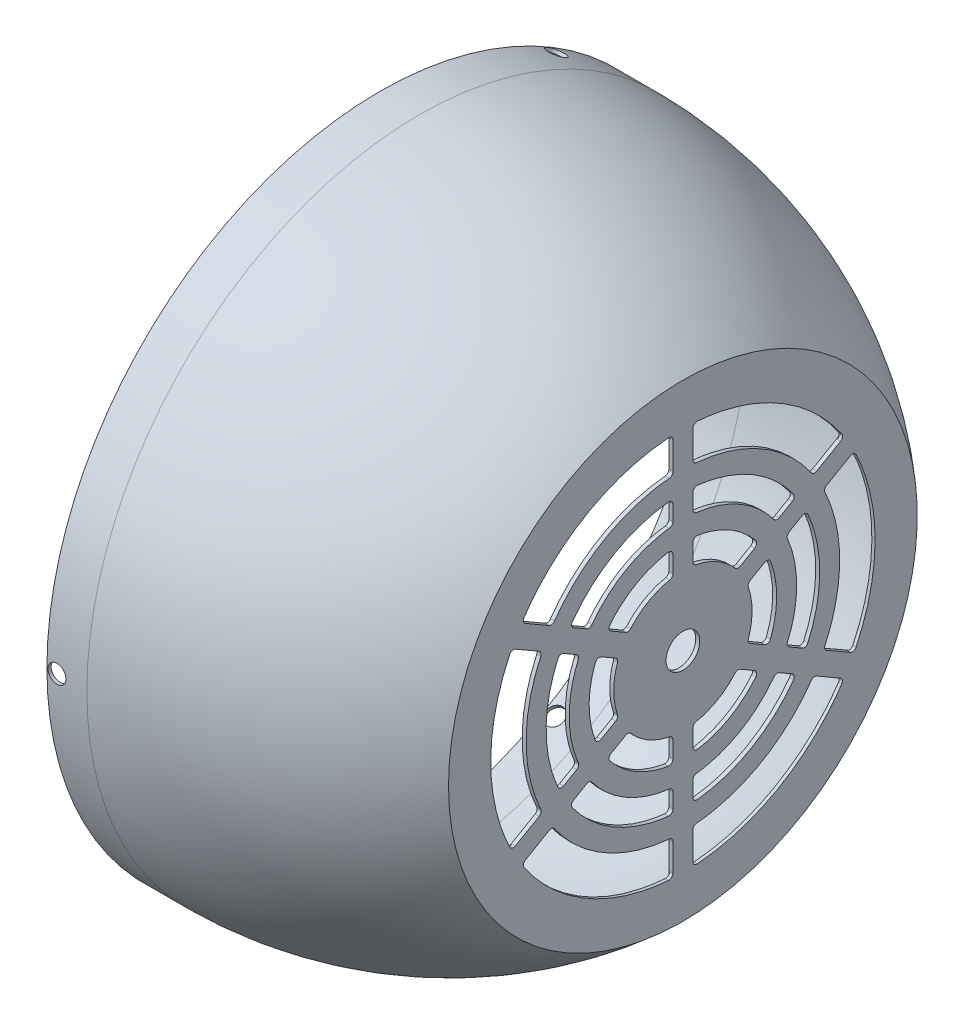
from build123d import *

# Parameters (mm, degrees)
RESPIRADOURO1_START              = 75
RESPIRADOURO1_DEPTH              = 0.8
RESPIRADOURO1_START_2            = 74.8
RESPIRADOURO1_2_DEPTH            = 0.2
FURO_DE_DI_METRO_4_5_4_5_1_D     = 4.5
FURO_DE_DI_METRO_4_5_4_5_1_DEPTH = 20
CIRPATTERN1_COUNT                = 3


with BuildPart() as part:
    # Esboço1 → Revolução1 (revolve)
    with BuildSketch(Plane.XY, mode=Mode.PRIVATE) as revolu_o1_sk:
        with BuildLine():
            Line((0, 82.5), (10, 82.5))
            ThreePointArc((10, 82.5), (44.684631464, 76.245520018), (75, 58.26996411))
            Line((75, 58.26996411), (75, 0))
            Line((75, 0), (75.8, 0))
            Line((75.8, 0), (75.8, 58.634605337))
            ThreePointArc((75.8, 58.634605337), (45.135529361, 76.931035824), (10, 83.3))
            Line((10, 83.3), (0, 83.3))
            Line((0, 83.3), (0, 82.5))
        make_face()
    revolve(revolu_o1_sk.sketch.rotate(Axis((0, 0, 0), (1, 0, 0)), 90), axis=Axis((0, 0, 0), (1, 0, 0)))

    # Respiradouro1: read off the stored shape, not the designer's step
    # Respiradouro1 outline → Respiradouro1 (cut)
    with BuildSketch(Plane.YZ.offset(RESPIRADOURO1_START)):
        with BuildLine():
            add(Edge.make_bspline(
                [(11.202317924, 26.165455629), (11.099201301, 26.209607209), (9.278991285, 26.976241101), (5.588584912, 28.095713635), (0, 28.646141206), (-5.588584912, 28.095713635), (-9.278991285, 26.976241101), (-11.099201301, 26.209607209), (-11.202317924, 26.165455629)],
                knots=[0.435618298, 0.435618298, 0.435618298, 0.435618298, 0.4375, 0.46875, 0.5, 0.53125, 0.5625, 0.564381702, 0.564381702, 0.564381702, 0.564381702], degree=3))
            ThreePointArc((11.202317924, 26.165455629), (11.911747556, 26.135915026), (12.46195186, 26.584733783))
            Line((12.46195186, 26.584733783), (14.351595385, 29.857692377))
            ThreePointArc((14.351595385, 29.857692377), (14.436476067, 30.667171967), (13.891417662, 31.271633108))
            add(Edge.make_bspline(
                [(13.891417662, 31.271633108), (13.627304229, 31.388916232), (12.332608407, 31.944388515), (9.949287535, 32.798114477), (6.686450495, 33.614199908), (3.35952005, 34.108917613), (0.000167139, 34.272774263), (-3.359351906, 34.108934174), (-6.686122639, 33.614265123), (-9.949125853, 32.798163523), (-12.33245469, 31.944454403), (-13.627304232, 31.388916275), (-13.891417641, 31.271633179)],
                knots=[0.433467712, 0.433467712, 0.433467712, 0.433467712, 0.437499982, 0.453123814, 0.468749982, 0.484373814, 0.499999982, 0.515623814, 0.531249982, 0.546873814, 0.562499982, 0.566532252, 0.566532252, 0.566532252, 0.566532252], degree=3))
            ThreePointArc((-13.891417641, 31.271633179), (-14.436476087, 30.667172041), (-14.351595414, 29.857692426))
            Line((-14.351595414, 29.857692426), (-12.46195186, 26.584733783))
            ThreePointArc((-12.46195186, 26.584733783), (-11.911747555, 26.135915026), (-11.202317924, 26.165455629))
        make_face()
        with BuildLine():
            ThreePointArc((8.929084626, 20.465628237), (9.00579619, 21.299165355), (8.421961382, 21.899003424))
            add(Edge.make_bspline(
                [(8.421961382, 21.899003424), (7.175195583, 22.378410789), (4.406987657, 23.179859838), (0, 23.613910237), (-4.406987659, 23.179859838), (-7.175195586, 22.378410788), (-8.421961399, 21.899003418)],
                knots=[0.441567134, 0.441567134, 0.441567134, 0.441567134, 0.46875, 0.5, 0.53125, 0.558432866, 0.558432866, 0.558432866, 0.558432866], degree=3))
            ThreePointArc((-8.421961399, 21.899003418), (-9.00579619, 21.299165355), (-8.929084626, 20.465628237))
            Line((-8.929084626, 20.465628237), (-6.820623286, 16.813666071))
            ThreePointArc((-6.820623286, 16.813666071), (-6.304996669, 16.377065468), (-5.629416197, 16.368014512))
            add(Edge.make_bspline(
                [(5.629416235, 16.368014499), (4.893356498, 16.62112374), (3.04408919, 17.120832539), (0, 17.420649155), (-3.04408919, 17.120832539), (-4.893356498, 16.62112374), (-5.629416197, 16.368014512)],
                knots=[0.447279142, 0.447279142, 0.447279142, 0.447279142, 0.46875, 0.5, 0.53125, 0.552720858, 0.552720858, 0.552720858, 0.552720858], degree=3))
            ThreePointArc((5.629416235, 16.368014499), (6.304996669, 16.377065468), (6.820623286, 16.813666071))
            Line((6.820623286, 16.813666071), (8.929084626, 20.465628237))
        make_face()
        with BuildLine():
            add(Edge.make_bspline(
                [(16.57920603, 35.541639505), (16.06063152, 35.783430625), (14.361785376, 36.530786118), (11.403086127, 37.590617055), (7.663475431, 38.525950281), (3.850413438, 39.092955633), (0.000183853, 39.280754839), (-3.850228479, 39.09297385), (-7.66311479, 38.526022017), (-11.402908276, 37.590671006), (-14.361617076, 36.530860112), (-16.060631604, 35.783430673), (-16.579206096, 35.541639576)],
                knots=[0.430534071, 0.430534071, 0.430534071, 0.430534071, 0.437499984, 0.453123863, 0.468749984, 0.484373863, 0.499999984, 0.515623863, 0.531249984, 0.546873863, 0.562499984, 0.569465897, 0.569465897, 0.569465897, 0.569465897], degree=3))
            ThreePointArc((16.57920603, 35.541639505), (17.302513666, 35.494252256), (17.867815032, 35.947963456))
            Line((17.867815032, 35.947963456), (21.308612208, 41.907598983))
            ThreePointArc((21.308612208, 41.907598983), (21.398189847, 42.702256112), (20.876655416, 43.308478797))
            add(Edge.make_bspline(
                [(20.876655416, 43.308478797), (20.061216664, 43.701379561), (17.798043902, 44.714090442), (13.978954634, 46.082117527), (9.39456772, 47.228738911), (4.720177793, 47.923821321), (0.000183853, 48.154041177), (-4.719992834, 47.923839538), (-9.394207079, 47.228810647), (-13.978776783, 46.082171478), (-17.797876126, 44.714165491), (-20.061216745, 43.701379633), (-20.876655468, 43.308478879)],
                knots=[0.428510709, 0.428510709, 0.428510709, 0.428510709, 0.437499987, 0.453124073, 0.468749987, 0.484374073, 0.499999987, 0.515624073, 0.531249987, 0.546874073, 0.562499987, 0.571489266, 0.571489266, 0.571489266, 0.571489266], degree=3))
            ThreePointArc((-20.876655468, 43.308478879), (-21.398189896, 42.702256194), (-21.308612256, 41.907599066))
            Line((-21.308612256, 41.907599066), (-17.867815078, 35.947963535))
            ThreePointArc((-17.867815078, 35.947963535), (-17.302513722, 35.494252339), (-16.579206096, 35.541639576))
        make_face()
        with BuildLine():
            ThreePointArc((27.067560602, 39.733807858), (26.28186878, 39.882200138), (25.638578861, 39.40732122))
            Line((25.638578861, 39.40732122), (22.197876991, 33.447850769))
            ThreePointArc((22.197876991, 33.447850769), (22.087632694, 32.73129253), (22.490525042, 32.128559362))
            add(Edge.make_bspline(
                [(39.069802621, 3.413050447), (39.057263696, 3.55671349), (38.925234666, 4.978314499), (38.526022017, 7.66311479), (37.590671005, 11.402908276), (36.290755775, 15.031924229), (34.643779755, 18.517380702), (32.66085614, 21.82306525), (30.365547477, 24.920240572), (27.775818121, 27.775558113), (25.130646219, 30.174722477), (23.309816803, 31.55518176), (22.490525042, 32.128559362)],
                knots=[0.263868157, 0.263868157, 0.263868157, 0.263868157, 0.265623863, 0.281249984, 0.296873863, 0.312499984, 0.328123863, 0.343749984, 0.359373863, 0.374999984, 0.390623863, 0.402798226, 0.402798226, 0.402798226, 0.402798226], degree=3))
            ThreePointArc((39.069802621, 3.413050447), (39.390348834, 2.762792583), (40.066015337, 2.5))
            Line((40.066015337, 2.5), (46.94749146, 2.5))
            ThreePointArc((46.94749146, 2.5), (47.680364043, 2.819634086), (47.94473451, 3.574204447))
            add(Edge.make_bspline(
                [(47.94473451, 3.574204447), (47.916481198, 3.953904314), (47.748240088, 5.900935754), (47.228810647, 9.394207079), (46.082171477, 13.978776783), (44.488603409, 18.427583902), (42.46959141, 22.700364179), (40.038724092, 26.752799009), (37.224928762, 30.549589311), (34.050179062, 34.049919054), (30.656259967, 37.128191268), (28.249276526, 38.928889255), (27.067560602, 39.733807858)],
                knots=[0.261842752, 0.261842752, 0.261842752, 0.261842752, 0.265624073, 0.281249987, 0.296874073, 0.312499987, 0.328124073, 0.343749987, 0.359374073, 0.374999987, 0.390624073, 0.40482344, 0.40482344, 0.40482344, 0.40482344], degree=3))
        make_face()
        with BuildLine():
            Line((-22.197877028, 33.447850833), (-25.638578876, 39.407321247))
            ThreePointArc((-25.638578876, 39.407321247), (-26.28186876, 39.882200157), (-27.067560557, 39.733807926))
            add(Edge.make_bspline(
                [(-27.067560557, 39.733807926), (-28.249124374, 38.928993057), (-30.656116997, 37.128309829), (-34.049921737, 34.050175863), (-37.224815192, 30.54973107), (-40.038526477, 26.753094103), (-42.469507903, 22.700520733), (-44.488469057, 18.427908151), (-46.082119989, 13.978946557), (-47.228742169, 9.394551326), (-47.74821635, 5.901110579), (-47.916468093, 3.954079667), (-47.944734441, 3.574204409)],
                knots=[0.595176533, 0.595176533, 0.595176533, 0.595176533, 0.609374073, 0.624999987, 0.640624114, 0.656249987, 0.671874156, 0.687499987, 0.703124156, 0.718749987, 0.734374156, 0.738157224, 0.738157224, 0.738157224, 0.738157224], degree=3))
            ThreePointArc((-47.944734441, 3.574204409), (-47.680363959, 2.819634072), (-46.947491389, 2.5))
            Line((-46.947491389, 2.5), (-40.066015297, 2.5))
            ThreePointArc((-40.066015297, 2.5), (-39.390348765, 2.762792608), (-39.069802575, 3.413050524))
            add(Edge.make_bspline(
                [(-22.490525142, 32.128559381), (-23.309666011, 31.555287476), (-25.130504144, 30.174841766), (-27.775560795, 27.775814921), (-30.365433908, 24.920382331), (-32.660658525, 21.823360345), (-34.643696248, 18.517537255), (-36.290621423, 15.032248479), (-37.590619517, 11.40307805), (-38.525953539, 7.663459036), (-38.925209835, 4.978489073), (-39.057248372, 3.556888726), (-39.069802575, 3.413050524)],
                knots=[0.597201742, 0.597201742, 0.597201742, 0.597201742, 0.609373863, 0.624999984, 0.640623914, 0.656249984, 0.671873966, 0.687499984, 0.703123966, 0.718749984, 0.734373966, 0.736131812, 0.736131812, 0.736131812, 0.736131812], degree=3))
            ThreePointArc((-22.490525142, 32.128559381), (-22.087632739, 32.731292555), (-22.197877028, 33.447850833))
        make_face()
        with BuildLine():
            ThreePointArc((47.944734437, -3.574204407), (47.680363954, -2.819634072), (46.947491385, -2.5))
            Line((46.947491385, -2.5), (40.066015295, -2.5))
            ThreePointArc((40.066015295, -2.5), (39.390348762, -2.76279261), (39.069802572, -3.413050527))
            add(Edge.make_bspline(
                [(22.490525132, -32.128559389), (23.309665984, -31.555287482), (25.130504066, -30.174841679), (27.775558113, -27.775818127), (30.365429573, -24.920384237), (32.660651853, -21.823370988), (34.643692144, -18.51754461), (36.290615059, -15.032263946), (37.590617055, -11.403086127), (38.525950281, -7.663475431), (38.925208652, -4.978497386), (39.057247642, -3.556897071), (39.069802572, -3.413050527)],
                knots=[0.097201742, 0.097201742, 0.097201742, 0.097201742, 0.109373863, 0.124999984, 0.140623863, 0.156249984, 0.171873863, 0.187499984, 0.203123863, 0.218749984, 0.234373863, 0.236131812, 0.236131812, 0.236131812, 0.236131812], degree=3))
            ThreePointArc((22.490525132, -32.128559389), (22.087632739, -32.731292562), (22.197877029, -33.447850834))
            Line((22.197877029, -33.447850834), (25.638578878, -39.40732125))
            ThreePointArc((25.638578878, -39.40732125), (26.281868761, -39.882200159), (27.067560557, -39.73380793))
            add(Edge.make_bspline(
                [(27.067560557, -39.73380793), (28.249124356, -38.928993078), (30.656116896, -37.12830972), (34.049919055, -34.050179068), (37.224810858, -30.549732976), (40.038519805, -26.753104747), (42.469503799, -22.700528088), (44.488462694, -18.427923618), (46.082117527, -13.978954634), (47.228738911, -9.39456772), (47.748215219, -5.901118904), (47.916467469, -3.954088017), (47.944734437, -3.574204407)],
                knots=[0.095176533, 0.095176533, 0.095176533, 0.095176533, 0.109374073, 0.124999987, 0.140624073, 0.156249987, 0.171874073, 0.187499987, 0.203124073, 0.218749987, 0.234374073, 0.238157223, 0.238157223, 0.238157223, 0.238157223], degree=3))
        make_face()
        with BuildLine():
            Line((-40.066015336, -2.5), (-46.947491457, -2.5))
            ThreePointArc((-46.947491457, -2.5), (-47.68036404, -2.819634086), (-47.944734507, -3.574204445))
            add(Edge.make_bspline(
                [(-47.944734507, -3.574204445), (-47.916480574, -3.953912664), (-47.748238959, -5.900944079), (-47.228807386, -9.394223472), (-46.082169026, -13.978784867), (-44.488597013, -18.427599343), (-42.469587429, -22.70037163), (-40.038714806, -26.752812906), (-37.224923404, -30.549595844), (-34.050167242, -34.049930866), (-30.656253472, -37.128196672), (-28.249269612, -38.928893922), (-27.067560612, -39.733807839)],
                knots=[0.761842752, 0.761842752, 0.761842752, 0.761842752, 0.765624156, 0.781249987, 0.796874156, 0.812499987, 0.828124156, 0.843749987, 0.859374156, 0.874999987, 0.890624156, 0.90482344, 0.90482344, 0.90482344, 0.90482344], degree=3))
            ThreePointArc((-27.067560612, -39.733807839), (-26.281868784, -39.882200132), (-25.638578856, -39.407321212))
            Line((-25.638578856, -39.407321212), (-22.197876983, -33.447850754))
            ThreePointArc((-22.197876983, -33.447850754), (-22.087632685, -32.731292519), (-22.490525026, -32.128559352))
            add(Edge.make_bspline(
                [(-39.06980262, -3.413050451), (-39.057262966, -3.556721834), (-38.925233484, -4.978322812), (-38.526018756, -7.663131183), (-37.590668554, -11.40291636), (-36.290749378, -15.031939671), (-34.643775774, -18.517388153), (-32.660846854, -21.823079147), (-30.365542119, -24.920247105), (-27.775806301, -27.775569925), (-25.130639756, -30.174727923), (-23.309809932, -31.555186538), (-22.490525026, -32.128559352)],
                knots=[0.763868157, 0.763868157, 0.763868157, 0.763868157, 0.765623966, 0.781249984, 0.796873966, 0.812499984, 0.828123966, 0.843749984, 0.859373966, 0.874999984, 0.890623966, 0.902798227, 0.902798227, 0.902798227, 0.902798227], degree=3))
            ThreePointArc((-39.06980262, -3.413050451), (-39.390348831, -2.762792584), (-40.066015336, -2.5))
        make_face()
        with BuildLine():
            ThreePointArc((20.876655724, -43.308479079), (21.39819006, -42.702256388), (21.308612402, -41.907599319))
            Line((21.308612402, -41.907599319), (17.867815251, -35.947963835))
            ThreePointArc((17.867815251, -35.947963835), (17.302513866, -35.494252629), (16.579206213, -35.541639901))
            add(Edge.make_bspline(
                [(-16.579205918, -35.541639193), (-16.060631426, -35.783430266), (-14.361777682, -36.530789338), (-11.403078644, -37.590624016), (-7.663326146, -38.52596939), (-3.850277639, -39.093032824), (-1.283390751, -39.218179622), (0, -39.21815814), (1.283485652, -39.218136656), (3.850359898, -39.092894796), (7.663251848, -38.526005748), (11.402907657, -37.590666334), (14.361617123, -36.530860262), (16.060631703, -35.783431046), (16.579206213, -35.541639901)],
                knots=[0.930534072, 0.930534072, 0.930534072, 0.930534072, 0.937499984, 0.953123966, 0.968749984, 0.984375603, 1, 1, 1, 1.015625552, 1.031249984, 1.046873863, 1.062499984, 1.069465898, 1.069465898, 1.069465898, 1.069465898], degree=3))
            ThreePointArc((-16.579205918, -35.541639193), (-17.302513528, -35.494251977), (-17.867814866, -35.947963168))
            Line((-17.867814866, -35.947963168), (-21.308612068, -41.90759874))
            ThreePointArc((-21.308612068, -41.90759874), (-21.39818969, -42.702255926), (-20.87665517, -43.308478606))
            add(Edge.make_bspline(
                [(-20.87665517, -43.308478606), (-20.061216473, -43.701379225), (-17.79803615, -44.714093481), (-13.978947151, -46.082124488), (-9.394418433, -47.228758021), (-4.720041991, -47.923898512), (-1.573312201, -48.077325744), (0, -48.077304262), (1.573407102, -48.077282778), (4.720124251, -47.923760484), (9.394344135, -47.228794378), (13.978776164, -46.082166806), (17.797876258, -44.714165878), (20.061216946, -43.701379982), (20.876655724, -43.308479079)],
                knots=[0.92851071, 0.92851071, 0.92851071, 0.92851071, 0.937499987, 0.953124156, 0.968749987, 0.984375492, 1, 1, 1, 1.01562545, 1.031249987, 1.046874073, 1.062499987, 1.071489267, 1.071489267, 1.071489267, 1.071489267], degree=3))
        make_face()
        with BuildLine():
            add(Edge.make_bspline(
                [(28.261011834, 3.381236267), (28.173942649, 4.109176982), (27.766180628, 6.674909652), (26.465583546, 10.962403641), (23.818395923, 15.914943345), (20.580196014, 19.86070135), (18.142604453, 21.972583511), (17.058688757, 22.784215293)],
                knots=[0.26895169, 0.26895169, 0.26895169, 0.26895169, 0.28125, 0.3125, 0.34375, 0.375, 0.397715423, 0.397715423, 0.397715423, 0.397715423], degree=3))
            ThreePointArc((28.261011834, 3.381236267), (28.590143626, 2.752081663), (29.253934377, 2.5))
            Line((29.253934377, 2.5), (33.033650163, 2.5))
            ThreePointArc((33.033650163, 2.5), (33.777094293, 2.831201955), (34.028078125, 3.605418349))
            add(Edge.make_bspline(
                [(34.028078125, 3.605418349), (33.918914035, 4.635180475), (33.593781161, 6.768019895), (32.79816611, 9.949117838), (31.663983093, 13.115456736), (30.226981719, 16.156557756), (28.496865193, 19.040790552), (26.494186486, 21.743107609), (24.234629241, 24.234392886), (22.082470369, 26.186396289), (20.671783798, 27.276649103), (20.136110266, 27.66638417)],
                knots=[0.266800465, 0.266800465, 0.266800465, 0.266800465, 0.281249981, 0.296873697, 0.312499981, 0.328123756, 0.343749982, 0.359373814, 0.374999982, 0.390623814, 0.39986724, 0.39986724, 0.39986724, 0.39986724], degree=3))
            ThreePointArc((20.136110266, 27.66638417), (19.340200336, 27.835975703), (18.681760815, 27.357758907))
            Line((18.681760815, 27.357758907), (16.792046444, 24.084677604))
            ThreePointArc((16.792046444, 24.084677604), (16.678451484, 23.383819587), (17.058688757, 22.784215293))
        make_face()
        with BuildLine():
            ThreePointArc((22.188276378, 2.5), (22.94845769, 2.850289008), (23.176072687, 3.655751253))
            add(Edge.make_bspline(
                [(23.176072687, 3.655751253), (23.127469349, 3.964000524), (22.803276555, 5.783383742), (21.816408351, 9.036652221), (19.63424879, 13.119185613), (17.151249718, 16.144728737), (15.394657464, 17.724990954), (14.754042695, 18.243098216)],
                knots=[0.274899612, 0.274899612, 0.274899612, 0.274899612, 0.28125, 0.3125, 0.34375, 0.375, 0.391766435, 0.391766435, 0.391766435, 0.391766435], degree=3))
            ThreePointArc((14.754042695, 18.243098216), (13.942662602, 18.448763952), (13.259175226, 17.965565158))
            Line((13.259175226, 17.965565158), (11.150746978, 14.313660307))
            ThreePointArc((11.150746978, 14.313660307), (11.03046039, 13.648770479), (11.360471925, 13.059160664))
            add(Edge.make_bspline(
                [(16.98986342, 3.308849217), (16.985448633, 3.331519182), (16.76220805, 4.465723032), (16.094581198, 6.666593813), (14.484740399, 9.678394111), (12.784984456, 11.74955272), (11.662807277, 12.796174663), (11.360471925, 13.059160664)],
                knots=[0.280612904, 0.280612904, 0.280612904, 0.280612904, 0.28125, 0.3125, 0.34375, 0.375, 0.386053427, 0.386053427, 0.386053427, 0.386053427], degree=3))
            ThreePointArc((16.98986342, 3.308849217), (17.335480233, 2.728264688), (17.971424105, 2.5))
            Line((17.971424105, 2.5), (22.188276378, 2.5))
        make_face()
        with BuildLine():
            add(Edge.make_bspline(
                [(17.058688755, -22.784215295), (18.142604452, -21.972583512), (20.580196014, -19.860701351), (23.818395923, -15.914943345), (26.465583546, -10.962403641), (27.766180628, -6.674909652), (28.173942649, -4.109176982), (28.261011834, -3.381236267)],
                knots=[0.102284577, 0.102284577, 0.102284577, 0.102284577, 0.125, 0.15625, 0.1875, 0.21875, 0.23104831, 0.23104831, 0.23104831, 0.23104831], degree=3))
            ThreePointArc((17.058688755, -22.784215295), (16.678451484, -23.383819587), (16.792046444, -24.084677604))
            Line((16.792046444, -24.084677604), (18.681760867, -27.357758996))
            ThreePointArc((18.681760867, -27.357758996), (19.340200373, -27.83597579), (20.136110295, -27.666384275))
            add(Edge.make_bspline(
                [(20.136110295, -27.666384275), (20.671641623, -27.276752694), (22.08233588, -26.186511159), (24.234381089, -24.234641102), (26.494073806, -21.743244668), (28.496668186, -19.041086053), (30.226894211, -16.15671693), (31.663844307, -13.11579275), (32.798112023, -9.949295619), (33.593753544, -6.768201482), (33.918914185, -4.635180505), (34.028078169, -3.605418233)],
                knots=[0.100132724, 0.100132724, 0.100132724, 0.100132724, 0.109373697, 0.124999981, 0.140623697, 0.156249981, 0.171873697, 0.187499981, 0.203123697, 0.218749981, 0.2331995, 0.2331995, 0.2331995, 0.2331995], degree=3))
            ThreePointArc((34.028078169, -3.605418233), (33.777094286, -2.831201911), (33.033650195, -2.5))
            Line((33.033650195, -2.5), (29.253934377, -2.5))
            ThreePointArc((29.253934377, -2.5), (28.590143628, -2.752081661), (28.261011834, -3.381236267))
        make_face()
        with BuildLine():
            ThreePointArc((13.259175226, -17.965565158), (13.942662602, -18.448763952), (14.754042704, -18.243098209))
            add(Edge.make_bspline(
                [(14.754042704, -18.243098209), (15.39465746, -17.724990958), (17.151249716, -16.144728739), (19.63424879, -13.119185613), (21.816408351, -9.036652221), (22.803276555, -5.783383742), (23.127469349, -3.964000524), (23.176072693, -3.655751213)],
                knots=[0.108233565, 0.108233565, 0.108233565, 0.108233565, 0.125, 0.15625, 0.1875, 0.21875, 0.225100388, 0.225100388, 0.225100388, 0.225100388], degree=3))
            ThreePointArc((23.176072693, -3.655751213), (22.948457688, -2.850289006), (22.188276378, -2.5))
            Line((22.188276378, -2.5), (17.971424105, -2.5))
            ThreePointArc((17.971424105, -2.5), (17.335480233, -2.728264688), (16.98986342, -3.308849217))
            add(Edge.make_bspline(
                [(11.360471897, -13.059160689), (11.662807277, -12.796174663), (12.784984456, -11.74955272), (14.484740399, -9.678394111), (16.094581198, -6.666593813), (16.76220805, -4.465723032), (16.985448633, -3.331519182), (16.98986342, -3.308849217)],
                knots=[0.113946573, 0.113946573, 0.113946573, 0.113946573, 0.125, 0.15625, 0.1875, 0.21875, 0.219387096, 0.219387096, 0.219387096, 0.219387096], degree=3))
            ThreePointArc((11.360471897, -13.059160689), (11.03046039, -13.648770478), (11.150746978, -14.313660307))
            Line((11.150746978, -14.313660307), (13.259175226, -17.965565158))
        make_face()
        with BuildLine():
            add(Edge.make_bspline(
                [(-11.202317924, -26.165455629), (-11.099201301, -26.209607209), (-9.278991285, -26.976241101), (-5.588584912, -28.095713635), (-1.862861637, -28.462665349), (0, -28.462665349), (1.862861637, -28.462665349), (5.588584912, -28.095713635), (9.278991285, -26.976241101), (11.099201301, -26.209607209), (11.202317924, -26.165455629)],
                knots=[0.935618298, 0.935618298, 0.935618298, 0.935618298, 0.9375, 0.96875, 1, 1, 1, 1.03125, 1.0625, 1.064381702, 1.064381702, 1.064381702, 1.064381702], degree=3))
            ThreePointArc((-11.202317924, -26.165455629), (-11.911747556, -26.135915026), (-12.46195186, -26.584733783))
            Line((-12.46195186, -26.584733783), (-14.351595227, -29.857692103))
            ThreePointArc((-14.351595227, -29.857692103), (-14.436475932, -30.66717162), (-13.891417644, -31.271632772))
            add(Edge.make_bspline(
                [(-13.891417644, -31.271632772), (-13.627304209, -31.388915946), (-12.332608443, -31.944388717), (-9.949288137, -32.798118985), (-6.686317604, -33.614215757), (-3.35939266, -34.108993975), (-1.119762426, -34.218179622), (0, -34.21815814), (1.119857327, -34.218136656), (3.359474919, -34.108855947), (6.686243306, -33.614252114), (9.94911715, -32.798161302), (12.332446967, -31.944457487), (13.627304253, -31.388916574), (13.891417659, -31.27163353)],
                knots=[0.933467711, 0.933467711, 0.933467711, 0.933467711, 0.937499982, 0.953123814, 0.968749982, 0.984375691, 1, 1, 1, 1.015625633, 1.031249981, 1.046873697, 1.062499981, 1.066532252, 1.066532252, 1.066532252, 1.066532252], degree=3))
            ThreePointArc((13.891417659, -31.27163353), (14.436476227, -30.667172404), (14.351595579, -29.857692712))
            Line((14.351595579, -29.857692712), (12.46195186, -26.584733783))
            ThreePointArc((12.46195186, -26.584733783), (11.911747555, -26.135915026), (11.202317924, -26.165455629))
        make_face()
        with BuildLine():
            ThreePointArc((-8.929084626, -20.465628237), (-9.00579619, -21.299165355), (-8.421961382, -21.899003424))
            add(Edge.make_bspline(
                [(-8.421961382, -21.899003424), (-7.175195583, -22.378410789), (-4.406987657, -23.179859838), (-1.535615117, -23.462665349), (0, -23.462665349), (1.535615117, -23.462665349), (4.406987659, -23.179859838), (7.175195586, -22.378410788), (8.421961399, -21.899003418)],
                knots=[0.941567134, 0.941567134, 0.941567134, 0.941567134, 0.96875, 1, 1, 1, 1.03125, 1.058432866, 1.058432866, 1.058432866, 1.058432866], degree=3))
            ThreePointArc((8.421961399, -21.899003418), (9.00579619, -21.299165355), (8.929084626, -20.465628237))
            Line((8.929084626, -20.465628237), (6.820623286, -16.813666071))
            ThreePointArc((6.820623286, -16.813666071), (6.304996669, -16.377065468), (5.629416197, -16.368014512))
            add(Edge.make_bspline(
                [(-5.629416235, -16.368014499), (-4.893356498, -16.62112374), (-3.04408919, -17.120832539), (-1.132866684, -17.309071526), (0, -17.309071526), (1.132866684, -17.309071526), (3.04408919, -17.120832539), (4.893356498, -16.62112374), (5.629416197, -16.368014512)],
                knots=[0.947279142, 0.947279142, 0.947279142, 0.947279142, 0.96875, 1, 1, 1, 1.03125, 1.052720858, 1.052720858, 1.052720858, 1.052720858], degree=3))
            ThreePointArc((-5.629416235, -16.368014499), (-6.304996669, -16.377065468), (-6.820623286, -16.813666071))
            Line((-6.820623286, -16.813666071), (-8.929084626, -20.465628237))
        make_face()
        with BuildLine():
            add(Edge.make_bspline(
                [(-28.261011834, -3.381236267), (-28.173942649, -4.109176982), (-27.766180628, -6.674909652), (-26.465583546, -10.962403641), (-23.818395923, -15.914943345), (-20.580196014, -19.86070135), (-18.142604453, -21.972583511), (-17.058688757, -22.784215293)],
                knots=[0.76895169, 0.76895169, 0.76895169, 0.76895169, 0.78125, 0.8125, 0.84375, 0.875, 0.897715423, 0.897715423, 0.897715423, 0.897715423], degree=3))
            ThreePointArc((-28.261011834, -3.381236267), (-28.590143626, -2.752081663), (-29.253934377, -2.5))
            Line((-29.253934377, -2.5), (-33.033650166, -2.5))
            ThreePointArc((-33.033650166, -2.5), (-33.777094293, -2.83120195), (-34.02807813, -3.605418337))
            add(Edge.make_bspline(
                [(-34.02807813, -3.605418337), (-33.918914051, -4.635180476), (-33.593779937, -6.768028162), (-32.798163523, -9.949125853), (-31.663978625, -13.115468475), (-30.226977841, -16.156560473), (-28.496863186, -19.040794212), (-26.494186352, -21.743107536), (-24.234629276, -24.2343929), (-22.082470366, -26.186396308), (-20.671783787, -27.276649081), (-20.136110253, -27.666384148)],
                knots=[0.766800466, 0.766800466, 0.766800466, 0.766800466, 0.781249982, 0.796873814, 0.812499982, 0.828123814, 0.843749982, 0.859373814, 0.874999982, 0.890623814, 0.89986724, 0.89986724, 0.89986724, 0.89986724], degree=3))
            ThreePointArc((-20.136110253, -27.666384148), (-19.340200323, -27.835975682), (-18.681760803, -27.357758885))
            Line((-18.681760803, -27.357758885), (-16.792046444, -24.084677604))
            ThreePointArc((-16.792046444, -24.084677604), (-16.678451484, -23.383819587), (-17.058688757, -22.784215293))
        make_face()
        with BuildLine():
            ThreePointArc((-22.188276378, -2.5), (-22.94845769, -2.850289008), (-23.176072687, -3.655751253))
            add(Edge.make_bspline(
                [(-23.176072687, -3.655751253), (-23.127469349, -3.964000524), (-22.803276555, -5.783383742), (-21.816408351, -9.036652221), (-19.63424879, -13.119185613), (-17.151249718, -16.144728737), (-15.394657464, -17.724990954), (-14.754042695, -18.243098216)],
                knots=[0.774899612, 0.774899612, 0.774899612, 0.774899612, 0.78125, 0.8125, 0.84375, 0.875, 0.891766435, 0.891766435, 0.891766435, 0.891766435], degree=3))
            ThreePointArc((-14.754042695, -18.243098216), (-13.942662602, -18.448763952), (-13.259175226, -17.965565158))
            Line((-13.259175226, -17.965565158), (-11.150746977, -14.313660307))
            ThreePointArc((-11.150746977, -14.313660307), (-11.03046039, -13.648770479), (-11.360471925, -13.059160664))
            add(Edge.make_bspline(
                [(-16.98986342, -3.308849217), (-16.985448633, -3.331519182), (-16.76220805, -4.465723032), (-16.094581198, -6.666593813), (-14.484740399, -9.678394111), (-12.784984456, -11.74955272), (-11.662807277, -12.796174663), (-11.360471925, -13.059160664)],
                knots=[0.780612904, 0.780612904, 0.780612904, 0.780612904, 0.78125, 0.8125, 0.84375, 0.875, 0.886053427, 0.886053427, 0.886053427, 0.886053427], degree=3))
            ThreePointArc((-16.98986342, -3.308849217), (-17.335480233, -2.728264688), (-17.971424105, -2.5))
            Line((-17.971424105, -2.5), (-22.188276378, -2.5))
        make_face()
        with BuildLine():
            add(Edge.make_bspline(
                [(-17.058688755, 22.784215295), (-18.142604452, 21.972583512), (-20.580196014, 19.860701351), (-23.818395923, 15.914943345), (-26.465583546, 10.962403641), (-27.766180628, 6.674909652), (-28.173942649, 4.109176982), (-28.261011834, 3.381236267)],
                knots=[0.602284577, 0.602284577, 0.602284577, 0.602284577, 0.625, 0.65625, 0.6875, 0.71875, 0.73104831, 0.73104831, 0.73104831, 0.73104831], degree=3))
            ThreePointArc((-17.058688755, 22.784215295), (-16.678451484, 23.383819587), (-16.792046444, 24.084677604))
            Line((-16.792046444, 24.084677604), (-18.681760853, 27.357758972))
            ThreePointArc((-18.681760853, 27.357758972), (-19.340200359, 27.835975766), (-20.136110281, 27.666384252))
            add(Edge.make_bspline(
                [(-20.136110281, 27.666384252), (-20.671648384, 27.276747743), (-22.082342284, 26.186505711), (-24.234392906, 24.234629277), (-26.494079166, 21.74323814), (-28.496677471, 19.041072155), (-30.226898195, 16.15670948), (-31.663850702, 13.115777308), (-32.798114477, 9.949287535), (-33.593754801, 6.768193229), (-33.918914179, 4.635180504), (-34.028078167, 3.605418238)],
                knots=[0.600132724, 0.600132724, 0.600132724, 0.600132724, 0.609373814, 0.624999982, 0.640623814, 0.656249982, 0.671873814, 0.687499982, 0.703123814, 0.718749982, 0.7331995, 0.7331995, 0.7331995, 0.7331995], degree=3))
            ThreePointArc((-34.028078167, 3.605418238), (-33.777094287, 2.831201913), (-33.033650194, 2.5))
            Line((-33.033650194, 2.5), (-29.253934377, 2.5))
            ThreePointArc((-29.253934377, 2.5), (-28.590143628, 2.752081661), (-28.261011834, 3.381236267))
        make_face()
        with BuildLine():
            ThreePointArc((-13.259175226, 17.965565158), (-13.942662602, 18.448763952), (-14.754042704, 18.243098209))
            add(Edge.make_bspline(
                [(-14.754042704, 18.243098209), (-15.39465746, 17.724990958), (-17.151249716, 16.144728739), (-19.63424879, 13.119185613), (-21.816408351, 9.036652221), (-22.803276555, 5.783383742), (-23.127469349, 3.964000524), (-23.176072693, 3.655751213)],
                knots=[0.608233565, 0.608233565, 0.608233565, 0.608233565, 0.625, 0.65625, 0.6875, 0.71875, 0.725100388, 0.725100388, 0.725100388, 0.725100388], degree=3))
            ThreePointArc((-23.176072693, 3.655751213), (-22.948457688, 2.850289006), (-22.188276378, 2.5))
            Line((-22.188276378, 2.5), (-17.971424105, 2.5))
            ThreePointArc((-17.971424105, 2.5), (-17.335480233, 2.728264688), (-16.98986342, 3.308849217))
            add(Edge.make_bspline(
                [(-11.360471897, 13.059160689), (-11.662807277, 12.796174663), (-12.784984456, 11.74955272), (-14.484740399, 9.678394111), (-16.094581198, 6.666593813), (-16.76220805, 4.465723032), (-16.985448633, 3.331519182), (-16.98986342, 3.308849217)],
                knots=[0.613946573, 0.613946573, 0.613946573, 0.613946573, 0.625, 0.65625, 0.6875, 0.71875, 0.719387096, 0.719387096, 0.719387096, 0.719387096], degree=3))
            ThreePointArc((-11.360471897, 13.059160689), (-11.03046039, 13.648770478), (-11.150746978, 14.313660307))
            Line((-11.150746978, 14.313660307), (-13.259175226, 17.965565158))
        make_face()
        with BuildLine():
            add(Edge.make_bspline(
                [(0, -4.216062128), (0.276051892, -4.216249601), (0.828153458, -4.162995803), (1.623483878, -3.919599347), (2.358206405, -3.529464716), (2.999749359, -3.000015815), (3.529374005, -2.3583676), (3.919461322, -1.623695102), (4.163225167, -0.828215596), (4.242471161, -0.000185493), (4.163262947, 0.828025787), (3.919603247, 1.623352072), (3.529481678, 2.358207827), (3.000011272, 2.999748979), (2.358368818, 3.529374107), (1.623694776, 3.919461295), (0.828215683, 4.163225174), (0.00018547, 4.242471159), (-0.828025781, 4.163262948), (-1.623352073, 3.919603247), (-2.358207826, 3.529481678), (-2.999748979, 3.000011272), (-3.529374106, 2.35836882), (-3.919461297, 1.623694767), (-4.163225165, 0.828215719), (-4.242471193, 0.000185337), (-4.163262821, -0.828025287), (-3.919603723, -1.623353917), (-3.529479904, -2.358200949), (-3.000017896, -2.999774659), (-2.35834411, -3.529278315), (-1.623727525, -3.919850606), (-0.827854777, -4.161889297), (-0.275981929, -4.215874703), (0, -4.216062128)],
                knots=[0, 0, 0, 0, 0.031255171, 0.062499783, 0.093739439, 0.125000191, 0.156239847, 0.1875006, 0.218740255, 0.250001008, 0.281240664, 0.312501417, 0.343741072, 0.375001825, 0.406241481, 0.437502234, 0.468741889, 0.500002642, 0.531242298, 0.56250305, 0.593742706, 0.625003459, 0.656243115, 0.687503867, 0.718743523, 0.750004276, 0.781243931, 0.812504684, 0.84374434, 0.875005093, 0.906244748, 0.937505501, 0.968752751, 1, 1, 1, 1], degree=3))
        make_face()
    extrude(amount=RESPIRADOURO1_DEPTH, mode=Mode.SUBTRACT)

    # Respiradouro1 2 outline → Respiradouro1 2 (add)
    with BuildSketch(Plane.YZ.offset(RESPIRADOURO1_START_2)):
        with BuildLine():
            ThreePointArc((17.867815032, 35.947963456), (17.302513666, 35.494252256), (16.57920603, 35.541639506))
            add(Edge.make_bspline(
                [(16.57920603, 35.541639506), (16.06063152, 35.783430625), (14.361785376, 36.530786118), (11.403086127, 37.590617055), (7.663475431, 38.525950281), (3.850413438, 39.092955633), (0.000183853, 39.280754839), (-3.850228479, 39.09297385), (-7.66311479, 38.526022017), (-11.402908276, 37.590671006), (-14.361617076, 36.530860112), (-16.060631604, 35.783430673), (-16.579206096, 35.541639576)],
                knots=[0.430534071, 0.430534071, 0.430534071, 0.430534071, 0.437499984, 0.453123863, 0.468749984, 0.484373863, 0.499999984, 0.515623863, 0.531249984, 0.546873863, 0.562499984, 0.569465897, 0.569465897, 0.569465897, 0.569465897], degree=3))
            ThreePointArc((-16.579206096, 35.541639576), (-17.302513722, 35.494252339), (-17.867815078, 35.947963535))
            Line((-17.867815078, 35.947963535), (-21.841328559, 42.830290769))
            add(Edge.make_bspline(
                [(-26.17120904, 40.329863752), (-24.067638254, 41.695221018), (-21.841328559, 42.830290769)],
                knots=[0.575049797, 0.575049797, 0.575049797, 0.591618821, 0.591618821, 0.591618821], degree=2))
            Line((-26.17120904, 40.329863752), (-22.197877028, 33.447850833))
            ThreePointArc((-22.197877028, 33.447850833), (-22.087632739, 32.731292555), (-22.490525143, 32.12855938))
            add(Edge.make_bspline(
                [(-22.490525143, 32.12855938), (-23.309666011, 31.555287476), (-25.130504144, 30.174841766), (-27.775560795, 27.775814921), (-30.365433908, 24.920382331), (-32.660658525, 21.823360345), (-34.643696248, 18.517537255), (-36.290621423, 15.032248479), (-37.590619517, 11.40307805), (-38.525953539, 7.663459036), (-38.925209835, 4.978489073), (-39.057248372, 3.556888726), (-39.069802575, 3.413050524)],
                knots=[0.597201742, 0.597201742, 0.597201742, 0.597201742, 0.609373863, 0.624999984, 0.640623914, 0.656249984, 0.671873966, 0.687499984, 0.703123966, 0.718749984, 0.734373966, 0.736131812, 0.736131812, 0.736131812, 0.736131812], degree=3))
            ThreePointArc((-39.069802575, 3.413050524), (-39.390348765, 2.762792608), (-40.066015297, 2.5))
            Line((-40.066015297, 2.5), (-48.012591565, 2.5))
            add(Edge.make_bspline(
                [(-48.012609702, -2.5), (-48.077317294, -1.253151847), (-48.077304262, 0), (-48.077291228, 1.253220893), (-48.012591565, 2.5)],
                knots=[0.741730231, 0.741730231, 0.741730231, 0.750001291, 0.750001291, 0.75827106, 0.75827106, 0.75827106], degree=2))
            Line((-48.012609702, -2.5), (-40.066015336, -2.5))
            ThreePointArc((-40.066015336, -2.5), (-39.390348831, -2.762792584), (-39.06980262, -3.413050451))
            add(Edge.make_bspline(
                [(-39.06980262, -3.413050451), (-39.057262966, -3.556721834), (-38.925233484, -4.978322812), (-38.526018756, -7.663131183), (-37.590668554, -11.40291636), (-36.290749378, -15.031939671), (-34.643775774, -18.517388153), (-32.660846854, -21.823079147), (-30.365542119, -24.920247105), (-27.775806301, -27.775569925), (-25.130639756, -30.174727923), (-23.309809932, -31.555186538), (-22.490525026, -32.128559352)],
                knots=[0.763868157, 0.763868157, 0.763868157, 0.763868157, 0.765623966, 0.781249984, 0.796873966, 0.812499984, 0.828123966, 0.843749984, 0.859373966, 0.874999984, 0.890623966, 0.902798227, 0.902798227, 0.902798227, 0.902798227], degree=3))
            ThreePointArc((-22.490525026, -32.128559352), (-22.087632685, -32.731292519), (-22.197876983, -33.447850754))
            Line((-22.197876983, -33.447850754), (-26.17121473, -40.329873609))
            add(Edge.make_bspline(
                [(-21.841323637, -42.830282245), (-24.067909439, -41.695099066), (-26.17121473, -40.329873609)],
                knots=[0.908381623, 0.908381623, 0.908381623, 0.924951886, 0.924951886, 0.924951886], degree=2))
            Line((-21.841323637, -42.830282245), (-17.867814866, -35.947963168))
            ThreePointArc((-17.867814866, -35.947963168), (-17.302513528, -35.494251977), (-16.579205918, -35.541639193))
            add(Edge.make_bspline(
                [(-16.579205918, -35.541639193), (-16.060631426, -35.783430266), (-14.361777682, -36.530789338), (-11.403078644, -37.590624016), (-7.663326146, -38.52596939), (-3.850277639, -39.093032824), (-1.283390751, -39.218179622), (0, -39.21815814), (1.283485652, -39.218136656), (3.850359898, -39.092894796), (7.663251848, -38.526005748), (11.402907657, -37.590666334), (14.361617123, -36.530860262), (16.060631703, -35.783431046), (16.579206214, -35.541639901)],
                knots=[0.930534072, 0.930534072, 0.930534072, 0.930534072, 0.937499984, 0.953123966, 0.968749984, 0.984375603, 1, 1, 1, 1.015625552, 1.031249984, 1.046873863, 1.062499984, 1.069465898, 1.069465898, 1.069465898, 1.069465898], degree=3))
            ThreePointArc((16.579206214, -35.541639901), (17.302513866, -35.494252629), (17.867815251, -35.947963835))
            Line((17.867815251, -35.947963835), (21.841328559, -42.830290769))
            add(Edge.make_bspline(
                [(26.17120904, -40.329863752), (24.067638254, -41.695221018), (21.841328559, -42.830290769)],
                knots=[0.075049797, 0.075049797, 0.075049797, 0.091618821, 0.091618821, 0.091618821], degree=2))
            Line((26.17120904, -40.329863752), (22.197877029, -33.447850834))
            ThreePointArc((22.197877029, -33.447850834), (22.087632739, -32.731292562), (22.490525133, -32.128559388))
            add(Edge.make_bspline(
                [(22.490525133, -32.128559388), (23.309665984, -31.555287482), (25.130504066, -30.174841679), (27.775558113, -27.775818127), (30.365429573, -24.920384237), (32.660651853, -21.823370988), (34.643692144, -18.51754461), (36.290615059, -15.032263946), (37.590617055, -11.403086127), (38.525950281, -7.663475431), (38.925208652, -4.978497386), (39.057247642, -3.556897071), (39.069802572, -3.413050527)],
                knots=[0.097201742, 0.097201742, 0.097201742, 0.097201742, 0.109373863, 0.124999984, 0.140623863, 0.156249984, 0.171873863, 0.187499984, 0.203123863, 0.218749984, 0.234373863, 0.236131812, 0.236131812, 0.236131812, 0.236131812], degree=3))
            ThreePointArc((39.069802572, -3.413050527), (39.390348762, -2.76279261), (40.066015295, -2.5))
            Line((40.066015295, -2.5), (48.012590658, -2.5))
            add(Edge.make_bspline(
                [(48.012610608, 2.5), (48.077318598, 1.253148393), (48.077304262, 0), (48.077289925, -1.253224345), (48.012590658, -2.5)],
                knots=[0.241730296, 0.241730296, 0.241730296, 0.25000142, 0.25000142, 0.258271124, 0.258271124, 0.258271124], degree=2))
            Line((48.012610608, 2.5), (40.066015337, 2.5))
            ThreePointArc((40.066015337, 2.5), (39.390348834, 2.762792583), (39.069802621, 3.413050447))
            add(Edge.make_bspline(
                [(39.069802621, 3.413050447), (39.057263696, 3.55671349), (38.925234666, 4.978314499), (38.526022017, 7.66311479), (37.590671005, 11.402908276), (36.290755775, 15.031924229), (34.643779755, 18.517380702), (32.66085614, 21.82306525), (30.365547477, 24.920240572), (27.775818121, 27.775558113), (25.130646219, 30.174722477), (23.309816803, 31.55518176), (22.490525041, 32.128559362)],
                knots=[0.263868157, 0.263868157, 0.263868157, 0.263868157, 0.265623863, 0.281249984, 0.296873863, 0.312499984, 0.328123863, 0.343749984, 0.359373863, 0.374999984, 0.390623863, 0.402798226, 0.402798226, 0.402798226, 0.402798226], degree=3))
            ThreePointArc((22.490525041, 32.128559362), (22.087632694, 32.73129253), (22.197876991, 33.447850769))
            Line((22.197876991, 33.447850769), (26.171215001, 40.329874078))
            add(Edge.make_bspline(
                [(21.841323403, 42.830281838), (24.067922354, 41.695093257), (26.171215001, 40.329874078)],
                knots=[0.408381644, 0.408381644, 0.408381644, 0.424951966, 0.424951966, 0.424951966], degree=2))
            Line((21.841323403, 42.830281838), (17.867815032, 35.947963456))
        make_face()
        with BuildLine():
            ThreePointArc((-12.46195186, -26.584733783), (-11.911747556, -26.135915026), (-11.202317923, -26.16545563))
            add(Edge.make_bspline(
                [(-11.202317923, -26.16545563), (-11.099201301, -26.209607209), (-9.278991285, -26.976241101), (-5.588584912, -28.095713635), (-1.862861637, -28.462665349), (0, -28.462665349), (1.862861637, -28.462665349), (5.588584912, -28.095713635), (9.278991285, -26.976241101), (11.099201301, -26.209607209), (11.202317924, -26.165455629)],
                knots=[0.935618298, 0.935618298, 0.935618298, 0.935618298, 0.9375, 0.96875, 1, 1, 1, 1.03125, 1.0625, 1.064381702, 1.064381702, 1.064381702, 1.064381702], degree=3))
            ThreePointArc((11.202317924, -26.165455629), (11.911747555, -26.135915026), (12.46195186, -26.584733783))
            Line((12.46195186, -26.584733783), (14.351595579, -29.857692712))
            ThreePointArc((14.351595579, -29.857692712), (14.436476227, -30.667172404), (13.891417659, -31.271633531))
            add(Edge.make_bspline(
                [(-13.891417644, -31.271632772), (-13.627304209, -31.388915946), (-12.332608443, -31.944388717), (-9.949288137, -32.798118985), (-6.686317604, -33.614215757), (-3.35939266, -34.108993975), (-1.119762426, -34.218179622), (0, -34.21815814), (1.119857327, -34.218136656), (3.359474919, -34.108855947), (6.686243306, -33.614252114), (9.94911715, -32.798161302), (12.332446967, -31.944457487), (13.627304253, -31.388916574), (13.891417659, -31.271633531)],
                knots=[0.933467711, 0.933467711, 0.933467711, 0.933467711, 0.937499982, 0.953123814, 0.968749982, 0.984375691, 1, 1, 1, 1.015625633, 1.031249981, 1.046873697, 1.062499981, 1.066532252, 1.066532252, 1.066532252, 1.066532252], degree=3))
            ThreePointArc((-13.891417644, -31.271632772), (-14.436475932, -30.66717162), (-14.351595227, -29.857692103))
            Line((-14.351595227, -29.857692103), (-12.46195186, -26.584733783))
        make_face(mode=Mode.SUBTRACT)
        with BuildLine():
            ThreePointArc((-29.253934377, -2.5), (-28.590143626, -2.752081663), (-28.261011828, -3.381236322))
            add(Edge.make_bspline(
                [(-28.261011828, -3.381236322), (-28.173942649, -4.109176982), (-27.766180628, -6.674909652), (-26.465583546, -10.962403641), (-23.818395923, -15.914943345), (-20.580196014, -19.86070135), (-18.142604453, -21.972583511), (-17.058688757, -22.784215293)],
                knots=[0.76895169, 0.76895169, 0.76895169, 0.76895169, 0.78125, 0.8125, 0.84375, 0.875, 0.897715423, 0.897715423, 0.897715423, 0.897715423], degree=3))
            ThreePointArc((-17.058688757, -22.784215293), (-16.678451484, -23.383819587), (-16.792046444, -24.084677604))
            Line((-16.792046444, -24.084677604), (-18.681760803, -27.357758885))
            ThreePointArc((-18.681760803, -27.357758885), (-19.340200323, -27.835975682), (-20.136110254, -27.666384148))
            add(Edge.make_bspline(
                [(-34.02807813, -3.605418337), (-33.918914051, -4.635180476), (-33.593779937, -6.768028162), (-32.798163523, -9.949125853), (-31.663978625, -13.115468475), (-30.226977841, -16.156560473), (-28.496863186, -19.040794212), (-26.494186352, -21.743107536), (-24.234629276, -24.2343929), (-22.082470366, -26.186396308), (-20.671783787, -27.276649081), (-20.136110254, -27.666384148)],
                knots=[0.766800466, 0.766800466, 0.766800466, 0.766800466, 0.781249982, 0.796873814, 0.812499982, 0.828123814, 0.843749982, 0.859373814, 0.874999982, 0.890623814, 0.89986724, 0.89986724, 0.89986724, 0.89986724], degree=3))
            ThreePointArc((-34.02807813, -3.605418337), (-33.777094293, -2.83120195), (-33.033650166, -2.5))
            Line((-33.033650166, -2.5), (-29.253934377, -2.5))
        make_face(mode=Mode.SUBTRACT)
        with BuildLine():
            add(Edge.make_bspline(
                [(-8.421961394, -21.899003419), (-7.175195583, -22.378410789), (-4.406987657, -23.179859838), (-1.535615117, -23.462665349), (0, -23.462665349), (1.535615117, -23.462665349), (4.406987659, -23.179859838), (7.175195586, -22.378410788), (8.421961399, -21.899003418)],
                knots=[0.941567134, 0.941567134, 0.941567134, 0.941567134, 0.96875, 1, 1, 1, 1.03125, 1.058432866, 1.058432866, 1.058432866, 1.058432866], degree=3))
            ThreePointArc((-8.421961394, -21.899003419), (-9.00579619, -21.299165355), (-8.929084626, -20.465628237))
            Line((-8.929084626, -20.465628237), (-6.820623286, -16.813666071))
            ThreePointArc((-6.820623286, -16.813666071), (-6.304996669, -16.377065468), (-5.629416197, -16.368014512))
            add(Edge.make_bspline(
                [(-5.629416197, -16.368014512), (-4.893356498, -16.62112374), (-3.04408919, -17.120832539), (-1.132866684, -17.309071526), (0, -17.309071526), (1.132866684, -17.309071526), (3.04408919, -17.120832539), (4.893356498, -16.62112374), (5.629416235, -16.368014499)],
                knots=[0.947279142, 0.947279142, 0.947279142, 0.947279142, 0.96875, 1, 1, 1, 1.03125, 1.052720858, 1.052720858, 1.052720858, 1.052720858], degree=3))
            ThreePointArc((5.629416235, -16.368014499), (6.304996669, -16.377065468), (6.820623286, -16.813666071))
            Line((6.820623286, -16.813666071), (8.929084626, -20.465628237))
            ThreePointArc((8.929084626, -20.465628237), (9.00579619, -21.299165355), (8.421961399, -21.899003418))
        make_face(mode=Mode.SUBTRACT)
        with BuildLine():
            add(Edge.make_bspline(
                [(-23.176072693, -3.655751213), (-23.127469349, -3.964000524), (-22.803276555, -5.783383742), (-21.816408351, -9.036652221), (-19.63424879, -13.119185613), (-17.151249718, -16.144728737), (-15.394657464, -17.724990954), (-14.754042695, -18.243098216)],
                knots=[0.774899612, 0.774899612, 0.774899612, 0.774899612, 0.78125, 0.8125, 0.84375, 0.875, 0.891766435, 0.891766435, 0.891766435, 0.891766435], degree=3))
            ThreePointArc((-23.176072693, -3.655751213), (-22.94845769, -2.850289008), (-22.188276378, -2.5))
            Line((-22.188276378, -2.5), (-17.971424105, -2.5))
            ThreePointArc((-17.971424105, -2.5), (-17.335480233, -2.728264688), (-16.98986342, -3.308849217))
            add(Edge.make_bspline(
                [(-16.98986342, -3.308849217), (-16.985448633, -3.331519182), (-16.76220805, -4.465723032), (-16.094581198, -6.666593813), (-14.484740399, -9.678394111), (-12.784984456, -11.74955272), (-11.662807277, -12.796174663), (-11.360471897, -13.059160689)],
                knots=[0.780612904, 0.780612904, 0.780612904, 0.780612904, 0.78125, 0.8125, 0.84375, 0.875, 0.886053427, 0.886053427, 0.886053427, 0.886053427], degree=3))
            ThreePointArc((-11.360471897, -13.059160689), (-11.03046039, -13.648770479), (-11.150746977, -14.313660307))
            Line((-11.150746977, -14.313660307), (-13.259175226, -17.965565158))
            ThreePointArc((-13.259175226, -17.965565158), (-13.942662602, -18.448763952), (-14.754042695, -18.243098216))
        make_face(mode=Mode.SUBTRACT)
        with BuildLine():
            add(Edge.make_bspline(
                [(0, -4.216062128), (0.276051892, -4.216249601), (0.828153458, -4.162995803), (1.623483878, -3.919599347), (2.358206405, -3.529464716), (2.999749359, -3.000015815), (3.529374005, -2.3583676), (3.919461322, -1.623695102), (4.163225167, -0.828215596), (4.242471161, -0.000185493), (4.163262947, 0.828025787), (3.919603247, 1.623352072), (3.529481678, 2.358207827), (3.000011272, 2.999748979), (2.358368818, 3.529374107), (1.623694776, 3.919461295), (0.828215683, 4.163225174), (0.00018547, 4.242471159), (-0.828025781, 4.163262948), (-1.623352073, 3.919603247), (-2.358207826, 3.529481678), (-2.999748979, 3.000011272), (-3.529374106, 2.35836882), (-3.919461297, 1.623694767), (-4.163225165, 0.828215719), (-4.242471193, 0.000185337), (-4.163262821, -0.828025287), (-3.919603723, -1.623353917), (-3.529479904, -2.358200949), (-3.000017896, -2.999774659), (-2.35834411, -3.529278315), (-1.623727525, -3.919850606), (-0.827854777, -4.161889297), (-0.275981929, -4.215874703), (0, -4.216062128)],
                knots=[0, 0, 0, 0, 0.031255171, 0.062499783, 0.093739439, 0.125000191, 0.156239847, 0.1875006, 0.218740255, 0.250001008, 0.281240664, 0.312501417, 0.343741072, 0.375001825, 0.406241481, 0.437502234, 0.468741889, 0.500002642, 0.531242298, 0.56250305, 0.593742706, 0.625003459, 0.656243115, 0.687503867, 0.718743523, 0.750004276, 0.781243931, 0.812504684, 0.84374434, 0.875005093, 0.906244748, 0.937505501, 0.968752751, 1, 1, 1, 1], degree=3))
        make_face(mode=Mode.SUBTRACT)
        with BuildLine():
            add(Edge.make_bspline(
                [(14.754042688, -18.243098222), (15.39465746, -17.724990958), (17.151249716, -16.144728739), (19.63424879, -13.119185613), (21.816408351, -9.036652221), (22.803276555, -5.783383742), (23.127469349, -3.964000524), (23.176072693, -3.655751213)],
                knots=[0.108233565, 0.108233565, 0.108233565, 0.108233565, 0.125, 0.15625, 0.1875, 0.21875, 0.225100388, 0.225100388, 0.225100388, 0.225100388], degree=3))
            ThreePointArc((14.754042688, -18.243098222), (13.942662602, -18.448763952), (13.259175226, -17.965565158))
            Line((13.259175226, -17.965565158), (11.150746978, -14.313660307))
            ThreePointArc((11.150746978, -14.313660307), (11.03046039, -13.648770478), (11.360471927, -13.059160663))
            add(Edge.make_bspline(
                [(11.360471927, -13.059160663), (11.662807277, -12.796174663), (12.784984456, -11.74955272), (14.484740399, -9.678394111), (16.094581198, -6.666593813), (16.76220805, -4.465723032), (16.985448633, -3.331519182), (16.98986342, -3.308849217)],
                knots=[0.113946573, 0.113946573, 0.113946573, 0.113946573, 0.125, 0.15625, 0.1875, 0.21875, 0.219387096, 0.219387096, 0.219387096, 0.219387096], degree=3))
            ThreePointArc((16.98986342, -3.308849217), (17.335480233, -2.728264688), (17.971424105, -2.5))
            Line((17.971424105, -2.5), (22.188276378, -2.5))
            ThreePointArc((22.188276378, -2.5), (22.948457688, -2.850289006), (23.176072693, -3.655751213))
        make_face(mode=Mode.SUBTRACT)
        with BuildLine():
            ThreePointArc((16.792046444, -24.084677604), (16.678451484, -23.383819587), (17.058688807, -22.784215256))
            add(Edge.make_bspline(
                [(17.058688807, -22.784215256), (18.142604452, -21.972583512), (20.580196014, -19.860701351), (23.818395923, -15.914943345), (26.465583546, -10.962403641), (27.766180628, -6.674909652), (28.173942649, -4.109176982), (28.261011834, -3.381236267)],
                knots=[0.102284577, 0.102284577, 0.102284577, 0.102284577, 0.125, 0.15625, 0.1875, 0.21875, 0.23104831, 0.23104831, 0.23104831, 0.23104831], degree=3))
            ThreePointArc((28.261011834, -3.381236267), (28.590143628, -2.752081661), (29.253934377, -2.5))
            Line((29.253934377, -2.5), (33.033650195, -2.5))
            ThreePointArc((33.033650195, -2.5), (33.777094286, -2.831201911), (34.028078169, -3.605418233))
            add(Edge.make_bspline(
                [(20.136110295, -27.666384275), (20.671641623, -27.276752694), (22.08233588, -26.186511159), (24.234381089, -24.234641102), (26.494073806, -21.743244668), (28.496668186, -19.041086053), (30.226894211, -16.15671693), (31.663844307, -13.11579275), (32.798112023, -9.949295619), (33.593753544, -6.768201482), (33.918914185, -4.635180505), (34.028078169, -3.605418233)],
                knots=[0.100132724, 0.100132724, 0.100132724, 0.100132724, 0.109373697, 0.124999981, 0.140623697, 0.156249981, 0.171873697, 0.187499981, 0.203123697, 0.218749981, 0.2331995, 0.2331995, 0.2331995, 0.2331995], degree=3))
            ThreePointArc((20.136110295, -27.666384275), (19.340200373, -27.83597579), (18.681760867, -27.357758996))
            Line((18.681760867, -27.357758996), (16.792046444, -24.084677604))
        make_face(mode=Mode.SUBTRACT)
        with BuildLine():
            ThreePointArc((-16.792046444, 24.084677604), (-16.678451484, 23.383819587), (-17.058688807, 22.784215256))
            add(Edge.make_bspline(
                [(-17.058688807, 22.784215256), (-18.142604452, 21.972583512), (-20.580196014, 19.860701351), (-23.818395923, 15.914943345), (-26.465583546, 10.962403641), (-27.766180628, 6.674909652), (-28.173942649, 4.109176982), (-28.261011834, 3.381236267)],
                knots=[0.602284577, 0.602284577, 0.602284577, 0.602284577, 0.625, 0.65625, 0.6875, 0.71875, 0.73104831, 0.73104831, 0.73104831, 0.73104831], degree=3))
            ThreePointArc((-28.261011834, 3.381236267), (-28.590143628, 2.752081661), (-29.253934377, 2.5))
            Line((-29.253934377, 2.5), (-33.033650194, 2.5))
            ThreePointArc((-33.033650194, 2.5), (-33.777094287, 2.831201913), (-34.028078167, 3.605418238))
            add(Edge.make_bspline(
                [(-20.13611028, 27.666384252), (-20.671648384, 27.276747743), (-22.082342284, 26.186505711), (-24.234392906, 24.234629277), (-26.494079166, 21.74323814), (-28.496677471, 19.041072155), (-30.226898195, 16.15670948), (-31.663850702, 13.115777308), (-32.798114477, 9.949287535), (-33.593754801, 6.768193229), (-33.918914179, 4.635180504), (-34.028078167, 3.605418238)],
                knots=[0.600132724, 0.600132724, 0.600132724, 0.600132724, 0.609373814, 0.624999982, 0.640623814, 0.656249982, 0.671873814, 0.687499982, 0.703123814, 0.718749982, 0.7331995, 0.7331995, 0.7331995, 0.7331995], degree=3))
            ThreePointArc((-20.13611028, 27.666384252), (-19.340200359, 27.835975766), (-18.681760853, 27.357758972))
            Line((-18.681760853, 27.357758972), (-16.792046444, 24.084677604))
        make_face(mode=Mode.SUBTRACT)
        with BuildLine():
            add(Edge.make_bspline(
                [(-14.754042688, 18.243098222), (-15.39465746, 17.724990958), (-17.151249716, 16.144728739), (-19.63424879, 13.119185613), (-21.816408351, 9.036652221), (-22.803276555, 5.783383742), (-23.127469349, 3.964000524), (-23.176072693, 3.655751213)],
                knots=[0.608233565, 0.608233565, 0.608233565, 0.608233565, 0.625, 0.65625, 0.6875, 0.71875, 0.725100388, 0.725100388, 0.725100388, 0.725100388], degree=3))
            ThreePointArc((-14.754042688, 18.243098222), (-13.942662602, 18.448763952), (-13.259175226, 17.965565158))
            Line((-13.259175226, 17.965565158), (-11.150746978, 14.313660307))
            ThreePointArc((-11.150746978, 14.313660307), (-11.03046039, 13.648770478), (-11.360471927, 13.059160663))
            add(Edge.make_bspline(
                [(-11.360471927, 13.059160663), (-11.662807277, 12.796174663), (-12.784984456, 11.74955272), (-14.484740399, 9.678394111), (-16.094581198, 6.666593813), (-16.76220805, 4.465723032), (-16.985448633, 3.331519182), (-16.98986342, 3.308849217)],
                knots=[0.613946573, 0.613946573, 0.613946573, 0.613946573, 0.625, 0.65625, 0.6875, 0.71875, 0.719387096, 0.719387096, 0.719387096, 0.719387096], degree=3))
            ThreePointArc((-16.98986342, 3.308849217), (-17.335480233, 2.728264688), (-17.971424105, 2.5))
            Line((-17.971424105, 2.5), (-22.188276378, 2.5))
            ThreePointArc((-22.188276378, 2.5), (-22.948457688, 2.850289006), (-23.176072693, 3.655751213))
        make_face(mode=Mode.SUBTRACT)
        with BuildLine():
            add(Edge.make_bspline(
                [(8.421961394, 21.899003419), (7.175195583, 22.378410789), (4.406987657, 23.179859838), (0, 23.613910237), (-4.406987659, 23.179859838), (-7.175195586, 22.378410788), (-8.421961399, 21.899003418)],
                knots=[0.441567134, 0.441567134, 0.441567134, 0.441567134, 0.46875, 0.5, 0.53125, 0.558432866, 0.558432866, 0.558432866, 0.558432866], degree=3))
            ThreePointArc((8.421961394, 21.899003419), (9.00579619, 21.299165355), (8.929084626, 20.465628237))
            Line((8.929084626, 20.465628237), (6.820623286, 16.813666071))
            ThreePointArc((6.820623286, 16.813666071), (6.304996669, 16.377065468), (5.629416197, 16.368014512))
            add(Edge.make_bspline(
                [(5.629416197, 16.368014512), (4.893356498, 16.62112374), (3.04408919, 17.120832539), (0, 17.420649155), (-3.04408919, 17.120832539), (-4.893356498, 16.62112374), (-5.629416235, 16.368014499)],
                knots=[0.447279142, 0.447279142, 0.447279142, 0.447279142, 0.46875, 0.5, 0.53125, 0.552720858, 0.552720858, 0.552720858, 0.552720858], degree=3))
            ThreePointArc((-5.629416235, 16.368014499), (-6.304996669, 16.377065468), (-6.820623286, 16.813666071))
            Line((-6.820623286, 16.813666071), (-8.929084626, 20.465628237))
            ThreePointArc((-8.929084626, 20.465628237), (-9.00579619, 21.299165355), (-8.421961399, 21.899003418))
        make_face(mode=Mode.SUBTRACT)
        with BuildLine():
            ThreePointArc((12.46195186, 26.584733783), (11.911747556, 26.135915026), (11.202317923, 26.16545563))
            add(Edge.make_bspline(
                [(11.202317923, 26.16545563), (11.099201301, 26.209607209), (9.278991285, 26.976241101), (5.588584912, 28.095713635), (0, 28.646141206), (-5.588584912, 28.095713635), (-9.278991285, 26.976241101), (-11.099201301, 26.209607209), (-11.202317924, 26.165455629)],
                knots=[0.435618298, 0.435618298, 0.435618298, 0.435618298, 0.4375, 0.46875, 0.5, 0.53125, 0.5625, 0.564381702, 0.564381702, 0.564381702, 0.564381702], degree=3))
            ThreePointArc((-11.202317924, 26.165455629), (-11.911747555, 26.135915026), (-12.46195186, 26.584733783))
            Line((-12.46195186, 26.584733783), (-14.351595414, 29.857692426))
            ThreePointArc((-14.351595414, 29.857692426), (-14.436476087, 30.667172041), (-13.891417641, 31.271633179))
            add(Edge.make_bspline(
                [(13.891417663, 31.271633108), (13.627304229, 31.388916232), (12.332608407, 31.944388515), (9.949287535, 32.798114477), (6.686450495, 33.614199908), (3.35952005, 34.108917613), (0.000167139, 34.272774263), (-3.359351906, 34.108934174), (-6.686122639, 33.614265123), (-9.949125853, 32.798163523), (-12.33245469, 31.944454403), (-13.627304232, 31.388916275), (-13.891417641, 31.271633179)],
                knots=[0.433467712, 0.433467712, 0.433467712, 0.433467712, 0.437499982, 0.453123814, 0.468749982, 0.484373814, 0.499999982, 0.515623814, 0.531249982, 0.546873814, 0.562499982, 0.566532252, 0.566532252, 0.566532252, 0.566532252], degree=3))
            ThreePointArc((13.891417663, 31.271633108), (14.436476067, 30.667171967), (14.351595385, 29.857692377))
            Line((14.351595385, 29.857692377), (12.46195186, 26.584733783))
        make_face(mode=Mode.SUBTRACT)
        with BuildLine():
            add(Edge.make_bspline(
                [(23.176072693, 3.655751213), (23.127469349, 3.964000524), (22.803276555, 5.783383742), (21.816408351, 9.036652221), (19.63424879, 13.119185613), (17.151249718, 16.144728737), (15.394657464, 17.724990954), (14.754042695, 18.243098216)],
                knots=[0.274899612, 0.274899612, 0.274899612, 0.274899612, 0.28125, 0.3125, 0.34375, 0.375, 0.391766435, 0.391766435, 0.391766435, 0.391766435], degree=3))
            ThreePointArc((23.176072693, 3.655751213), (22.94845769, 2.850289008), (22.188276378, 2.5))
            Line((22.188276378, 2.5), (17.971424105, 2.5))
            ThreePointArc((17.971424105, 2.5), (17.335480233, 2.728264688), (16.98986342, 3.308849217))
            add(Edge.make_bspline(
                [(16.98986342, 3.308849217), (16.985448633, 3.331519182), (16.76220805, 4.465723032), (16.094581198, 6.666593813), (14.484740399, 9.678394111), (12.784984456, 11.74955272), (11.662807277, 12.796174663), (11.360471897, 13.059160689)],
                knots=[0.280612904, 0.280612904, 0.280612904, 0.280612904, 0.28125, 0.3125, 0.34375, 0.375, 0.386053427, 0.386053427, 0.386053427, 0.386053427], degree=3))
            ThreePointArc((11.360471897, 13.059160689), (11.03046039, 13.648770479), (11.150746978, 14.313660307))
            Line((11.150746978, 14.313660307), (13.259175226, 17.965565158))
            ThreePointArc((13.259175226, 17.965565158), (13.942662602, 18.448763952), (14.754042695, 18.243098216))
        make_face(mode=Mode.SUBTRACT)
        with BuildLine():
            ThreePointArc((29.253934377, 2.5), (28.590143626, 2.752081663), (28.261011828, 3.381236322))
            add(Edge.make_bspline(
                [(28.261011828, 3.381236322), (28.173942649, 4.109176982), (27.766180628, 6.674909652), (26.465583546, 10.962403641), (23.818395923, 15.914943345), (20.580196014, 19.86070135), (18.142604453, 21.972583511), (17.058688757, 22.784215293)],
                knots=[0.26895169, 0.26895169, 0.26895169, 0.26895169, 0.28125, 0.3125, 0.34375, 0.375, 0.397715423, 0.397715423, 0.397715423, 0.397715423], degree=3))
            ThreePointArc((17.058688757, 22.784215293), (16.678451484, 23.383819587), (16.792046444, 24.084677604))
            Line((16.792046444, 24.084677604), (18.681760815, 27.357758907))
            ThreePointArc((18.681760815, 27.357758907), (19.340200336, 27.835975703), (20.136110267, 27.666384169))
            add(Edge.make_bspline(
                [(34.028078125, 3.605418349), (33.918914035, 4.635180475), (33.593781161, 6.768019895), (32.79816611, 9.949117838), (31.663983093, 13.115456736), (30.226981719, 16.156557756), (28.496865193, 19.040790552), (26.494186486, 21.743107609), (24.234629241, 24.234392886), (22.082470369, 26.186396289), (20.671783798, 27.276649103), (20.136110267, 27.666384169)],
                knots=[0.266800465, 0.266800465, 0.266800465, 0.266800465, 0.281249981, 0.296873697, 0.312499981, 0.328123756, 0.343749982, 0.359373814, 0.374999982, 0.390623814, 0.39986724, 0.39986724, 0.39986724, 0.39986724], degree=3))
            ThreePointArc((34.028078125, 3.605418349), (33.777094293, 2.831201955), (33.033650163, 2.5))
            Line((33.033650163, 2.5), (29.253934377, 2.5))
        make_face(mode=Mode.SUBTRACT)
    extrude(amount=RESPIRADOURO1_2_DEPTH)

    # Furo de diâmetro Ø4.5 (4.5)1
    with Locations(Plane(origin=(2.506167671, 0.00625732, 83.299999765), x_dir=(0, 0.999999997179, -7.511789e-05), z_dir=(0, 7.511789e-05, 0.999999997179))):
        with Locations((0, 0)):
            furo_de_di_metro_4_5_4_5_1 = Hole(FURO_DE_DI_METRO_4_5_4_5_1_D / 2, depth=FURO_DE_DI_METRO_4_5_4_5_1_DEPTH)

    # CirPattern1: Furo de diâmetro Ø4.5 (4.5)1 ×3 about axis
    cirpattern1_axis = Axis((0, 0, 0), (1, 0, 0))
    for i in range(1, CIRPATTERN1_COUNT):
        add(furo_de_di_metro_4_5_4_5_1.rotate(cirpattern1_axis, i * 360 / CIRPATTERN1_COUNT), mode=Mode.SUBTRACT)


solid = part.part
